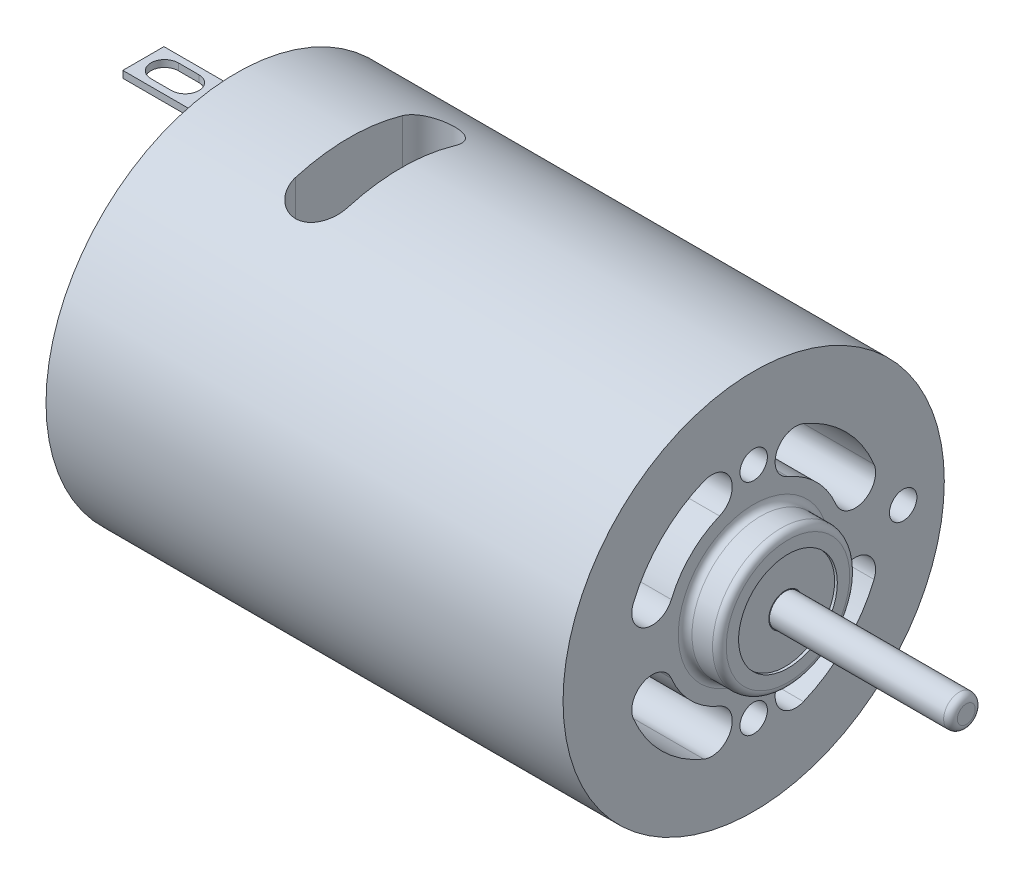
from build123d import *

# Parameters (mm, degrees)
SKETCH_1_R               = 13.9
EXTRUDE_1_DEPTH          = 37.7
CUT_EXTRUDE_1_DEPTH      = 43.517173001
CUT_EXTRUDE_1_DEPTH_BACK = 43.517173001
SKETCH_3_R               = 13.7
CUT_EXTRUDE_2_DEPTH      = 1
EXTRUDE_START            = 1
EXTRUDE_7_DEPTH          = 1
SKETCH_6_4_W             = 3
SKETCH_6_4_H             = 0.5
EXTRUDE_8_DEPTH          = 6.8
CUT_EXTRUDE_4_DEPTH      = 48.482523263
SKETCH_4_W               = 17.082447132
SKETCH_4_H               = 17
EXTRUDE_2_DEPTH          = 1
SKETCH_5_R               = 1.15
EXTRUDE_3_DEPTH          = 4
SKETCH_5_3_R             = 5
EXTRUDE_4_DEPTH          = 2
SKETCH_5_4_R             = 3
EXTRUDE_5_DEPTH          = 3
CUT_EXTRUDE_START        = 1
SKETCH_5_5_R             = 2.25
SKETCH_5_5_R_2           = 1.15
CUT_EXTRUDE_3_DEPTH      = 2
FILLET_1_R               = 1
FILLET_2_R               = 1
FILLET_3_R               = 0.5
EXTRUDE_START_2          = 2.5
SKETCH_8_R               = 5
SKETCH_8_R_2             = 3.6
EXTRUDE_9_DEPTH          = 2.5
EXTRUDE_START_3          = 2.3
SKETCH_8_3_R             = 3.6
SKETCH_8_3_R_2           = 1.2
EXTRUDE_10_DEPTH         = 2.3
EXTRUDE_START_4          = 15.5
SKETCH_8_4_R             = 1.15
EXTRUDE_11_DEPTH         = 13.2
FILLET_4_R               = 0.5
FILLET_5_R               = 0.5
FILLET_6_R               = 0.5
SKETCH_9_R               = 1
CUT_EXTRUDE_5_DEPTH      = 10
CUT_EXTRUDE_START_2      = -10
CUT_EXTRUDE_6_DEPTH      = 10
CHAMFER_1_SIZE           = 1


with BuildPart() as part:
    # 草图1 → 凸台-拉伸1 (new body)
    with BuildSketch(Plane(origin=(0, 0, 0), x_dir=(0, 0, -1), z_dir=(1, 0, 0))):
        Circle(SKETCH_1_R)
    extrude(amount=EXTRUDE_1_DEPTH)

    # 草图2 → 切除-拉伸1 (cut, two sides: drawn at the far end of the back side and taken through both)
    with BuildSketch(Plane(origin=(0, 0, 0), x_dir=(1, 0, 0), z_dir=(0, 1, 0)).offset(-CUT_EXTRUDE_1_DEPTH_BACK)):
        with BuildLine():
            Line((12, 3.9), (12, -3.9))
            ThreePointArc((12, -3.9), (10.1, -5.8), (8.2, -3.9))
            Line((8.2, -3.9), (8.2, 3.9))
            ThreePointArc((8.2, 3.9), (10.1, 5.8), (12, 3.9))
        make_face()
    extrude(amount=CUT_EXTRUDE_1_DEPTH + CUT_EXTRUDE_1_DEPTH_BACK, mode=Mode.SUBTRACT)

    # 草图3 → 切除-拉伸2 (cut)
    with BuildSketch(Plane.ZY):
        Circle(SKETCH_3_R)
    extrude(amount=-CUT_EXTRUDE_2_DEPTH, mode=Mode.SUBTRACT)

    # 草图6 → 凸台-拉伸7 (add)
    with BuildSketch(Plane.ZY.offset(-1).offset(EXTRUDE_START)):
        with BuildLine():
            Line((-3.85, -9.1), (-3.85, -13.147908579))
            ThreePointArc((-3.85, -13.147908579), (0, -13.7), (3.85, -13.147908579))
            Line((3.85, -13.147908579), (3.85, -9.1))
            Line((3.85, -9.1), (-3.85, -9.1))
        make_face()
        with BuildLine():
            Line((3.85, 9.1), (3.85, 13.147908579))
            ThreePointArc((3.85, 13.147908579), (0, 13.7), (-3.85, 13.147908579))
            Line((-3.85, 13.147908579), (-3.85, 9.1))
            Line((-3.85, 9.1), (3.85, 9.1))
        make_face()
    extrude(amount=-EXTRUDE_7_DEPTH)

    # 草图6<4> → 凸台-拉伸8 (add)
    with BuildSketch(Plane.ZY.offset(-1).offset(EXTRUDE_START)):
        with Locations((0, -11.15)):
            Rectangle(SKETCH_6_4_W, SKETCH_6_4_H)
        with Locations((0, 11.15)):
            Rectangle(SKETCH_6_4_W, SKETCH_6_4_H)
    extrude(amount=EXTRUDE_8_DEPTH)

    # 草图7 → 切除-拉伸4 (cut, through all)
    with BuildSketch(Plane.XZ.offset(11.4)):
        with BuildLine():
            Line((-5.25, 1), (-3.75, 1))
            ThreePointArc((-3.75, 1), (-2.75, 0), (-3.75, -1))
            Line((-3.75, -1), (-5.25, -1))
            ThreePointArc((-5.25, -1), (-6.25, 0), (-5.25, 1))
        make_face()
    extrude(amount=-CUT_EXTRUDE_4_DEPTH, mode=Mode.SUBTRACT)

    # 草图4 → 凸台-拉伸2 (add)
    with BuildSketch(Plane.ZY.offset(-1)):
        Rectangle(SKETCH_4_W, SKETCH_4_H)
        with BuildLine():
            ThreePointArc((-8.541223566, 8.5), (-12.05, 0), (-8.541223566, -8.5))
            Line((-8.541223566, -8.5), (-8.541223566, 8.5))
        make_face()
        with BuildLine():
            Line((8.541223566, 8.5), (8.541223566, -8.5))
            ThreePointArc((8.541223566, -8.5), (11.138317736, -4.597866681), (12.05, 0))
            ThreePointArc((12.05, 0), (11.138317736, 4.597866681), (8.541223566, 8.5))
        make_face()
    extrude(amount=EXTRUDE_2_DEPTH)

    # 草图5 → 凸台-拉伸3 (add)
    with BuildSketch(Plane.ZY):
        Circle(SKETCH_5_R)
    extrude(amount=EXTRUDE_3_DEPTH)

    # 草图5<3> → 凸台-拉伸4 (add)
    with BuildSketch(Plane.ZY):
        Circle(SKETCH_5_3_R)
    extrude(amount=EXTRUDE_4_DEPTH)

    # 草图5<4> → 凸台-拉伸5 (add)
    with BuildSketch(Plane.ZY):
        Circle(SKETCH_5_4_R)
    extrude(amount=EXTRUDE_5_DEPTH)

    # 草图5<5> → 切除-拉伸3 (cut)
    with BuildSketch(Plane.ZY.offset(CUT_EXTRUDE_START)):
        Circle(SKETCH_5_5_R)
        Circle(SKETCH_5_5_R_2, mode=Mode.SUBTRACT)
    extrude(amount=CUT_EXTRUDE_3_DEPTH, mode=Mode.SUBTRACT)

    # 圆角1
    fillet_1_edges = [part.edges().sort_by_distance(p)[0] for p in [
        (-2, 0, -5),
    ]]
    fillet(fillet_1_edges, radius=FILLET_1_R)

    # 圆角2
    # the kernel refuses this fillet: 1 mm, written as the material it takes off along each edge
    with BuildSketch(Plane(origin=(-3, 0, 0), x_dir=(0, 0, 1), z_dir=(0, -1, 0))) as fillet_2_piece_1:
        with BuildLine():
            CenterArc((2, -0.968245837), FILLET_2_R, 0, 75.522487814)
            Line((2.25, 0), (2.255, 0.019364917))
            ThreePointArc((2.255, 0.019364917), (2.625, 0.02), (3, 0.02))
            Line((3, 0.02), (3.02, 0))
            Line((3.02, 0), (3.02, -0.968245837))
            Line((3.02, -0.968245837), (3, -0.968245837))
        make_face()
    revolve(axis=Axis((-3, 0, 0), (-1, 0, 0)), mode=Mode.SUBTRACT)

    # 圆角3
    fillet_3_edges = [part.edges().sort_by_distance(p)[0] for p in [
        (-4, 0, -1.15),
    ]]
    fillet(fillet_3_edges, radius=FILLET_3_R)

    # 草图8 → 凸台-拉伸9 (add)
    with BuildSketch(Plane(origin=(37.7, 0, 0), x_dir=(0, 0, -1), z_dir=(1, 0, 0)).offset(EXTRUDE_START_2)):
        with Locations(Location((0, 0, 0), (0, 0, 180))):
            Circle(SKETCH_8_R)
        Circle(SKETCH_8_R_2, mode=Mode.SUBTRACT)
    extrude(amount=-EXTRUDE_9_DEPTH)

    # 草图8<3> → 凸台-拉伸10 (add)
    with BuildSketch(Plane(origin=(37.7, 0, 0), x_dir=(0, 0, -1), z_dir=(1, 0, 0)).offset(EXTRUDE_START_3)):
        Circle(SKETCH_8_3_R)
        Circle(SKETCH_8_3_R_2, mode=Mode.SUBTRACT)
    extrude(amount=-EXTRUDE_10_DEPTH)

    # 圆角5
    fillet_5_edges = [part.edges().sort_by_distance(p)[0] for p in [
        (40.2, 0, -5),
    ]]
    fillet(fillet_5_edges, radius=FILLET_5_R)

    # 圆角6
    fillet_6_edges = [part.edges().sort_by_distance(p)[0] for p in [
        (37.7, 0, -5),
    ]]
    fillet(fillet_6_edges, radius=FILLET_6_R)

    # 草图9 → 切除-拉伸5 (cut)
    with BuildSketch(Plane(origin=(37.7, 0, 0), x_dir=(0, 0, -1), z_dir=(1, 0, 0))):
        with BuildLine():
            ThreePointArc((2.487442249, 6.005216987), (4.596194074, 4.596194082), (6.005216982, 2.48744226))
            ThreePointArc((6.005216982, 2.48744226), (7.965061461, 1.675648182), (8.776855536, 3.635492661))
            ThreePointArc((8.776855536, 3.635492661), (6.7175144, 6.717514442), (3.635492607, 8.776855559))
            ThreePointArc((3.635492607, 8.776855559), (1.675648173, 7.965061439), (2.487442249, 6.005216987))
        make_face()
        with BuildLine():
            ThreePointArc((6.005216945, -2.48744235), (4.596194039, -4.596194116), (2.487442249, -6.005216987))
            ThreePointArc((2.487442249, -6.005216987), (1.675648184, -7.965061466), (3.635492661, -8.776855536))
            ThreePointArc((3.635492661, -8.776855536), (6.717514416, -6.717514426), (8.776855531, -3.635492674))
            ThreePointArc((8.776855531, -3.635492674), (7.965061422, -1.675648166), (6.005216945, -2.48744235))
        make_face()
        with BuildLine():
            ThreePointArc((-6.005216994, 2.487442232), (-4.596194128, 4.596194027), (-2.487442365, 6.005216939))
            ThreePointArc((-2.487442365, 6.005216939), (-1.67564816, 7.965061408), (-3.635492661, 8.776855536))
            ThreePointArc((-3.635492661, 8.776855536), (-6.717514442, 6.7175144), (-8.776855559, 3.635492607))
            ThreePointArc((-8.776855559, 3.635492607), (-7.965061447, 1.675648176), (-6.005216994, 2.487442232))
        make_face()
        with BuildLine():
            ThreePointArc((-2.487442378, -6.005216933), (-4.596194133, -4.596194022), (-6.005216994, -2.487442232))
            ThreePointArc((-6.005216994, -2.487442232), (-7.965061447, -1.675648176), (-8.776855559, -3.635492607))
            ThreePointArc((-8.776855559, -3.635492607), (-6.717514442, -6.7175144), (-3.635492662, -8.776855536))
            ThreePointArc((-3.635492662, -8.776855536), (-1.675648157, -7.965061402), (-2.487442378, -6.005216933))
        make_face()
        with Locations((0, 8)):
            Circle(SKETCH_9_R)
        with Locations((0, -8)):
            Circle(SKETCH_9_R)
        with Locations((10.9, 0)):
            Circle(SKETCH_9_R)
    extrude(amount=-CUT_EXTRUDE_5_DEPTH, mode=Mode.SUBTRACT)

    # 草图11 → 切除-拉伸6 (cut)
    with BuildSketch(Plane.ZY.offset(CUT_EXTRUDE_START_2)):
        with BuildLine():
            Line((-7.25, 7.25), (-7.25, 2.8))
            Line((-7.25, 2.8), (-5.86600375, 2.8))
            ThreePointArc((-5.86600375, 2.8), (-4.596194078, 4.596194078), (-2.8, 5.86600375))
            Line((-2.8, 5.86600375), (-2.8, 7.25))
            Line((-2.8, 7.25), (-7.25, 7.25))
        make_face()
        with BuildLine():
            Line((2.8, 7.25), (2.8, 5.86600375))
            ThreePointArc((2.8, 5.86600375), (4.596194078, 4.596194078), (5.86600375, 2.8))
            Line((5.86600375, 2.8), (7.25, 2.8))
            Line((7.25, 2.8), (7.25, 7.25))
            Line((7.25, 7.25), (2.8, 7.25))
        make_face()
        with BuildLine():
            ThreePointArc((5.86600375, -2.8), (4.596194078, -4.596194078), (2.8, -5.86600375))
            Line((2.8, -5.86600375), (2.8, -7.25))
            Line((2.8, -7.25), (7.25, -7.25))
            Line((7.25, -7.25), (7.25, -2.8))
            Line((7.25, -2.8), (5.86600375, -2.8))
        make_face()
        with BuildLine():
            Line((-5.86600375, -2.8), (-7.25, -2.8))
            Line((-7.25, -2.8), (-7.25, -7.25))
            Line((-7.25, -7.25), (-2.8, -7.25))
            Line((-2.8, -7.25), (-2.8, -5.86600375))
            ThreePointArc((-2.8, -5.86600375), (-4.596194078, -4.596194078), (-5.86600375, -2.8))
        make_face()
    extrude(amount=CUT_EXTRUDE_6_DEPTH, mode=Mode.SUBTRACT)

    # 倒角1
    chamfer_1_edges = [part.edges().sort_by_distance(p)[0] for p in [
        (5, -7.25, -7.25),
        (5, -7.25, 7.25),
        (5, 7.25, 7.25),
        (5, 7.25, -7.25),
    ]]
    chamfer(chamfer_1_edges, length=CHAMFER_1_SIZE)


with BuildPart() as body_2:
    # 草图8<4> → 凸台-拉伸11 (new body)
    with BuildSketch(Plane(origin=(37.7, 0, 0), x_dir=(0, 0, -1), z_dir=(1, 0, 0)).offset(EXTRUDE_START_4)):
        Circle(SKETCH_8_4_R)
    extrude(amount=-EXTRUDE_11_DEPTH)

    # 圆角4
    fillet_4_edges = [body_2.edges().sort_by_distance(p)[0] for p in [
        (53.2, 0, 1.15),
    ]]
    fillet(fillet_4_edges, radius=FILLET_4_R)


solid = Compound([part.part, body_2.part])
